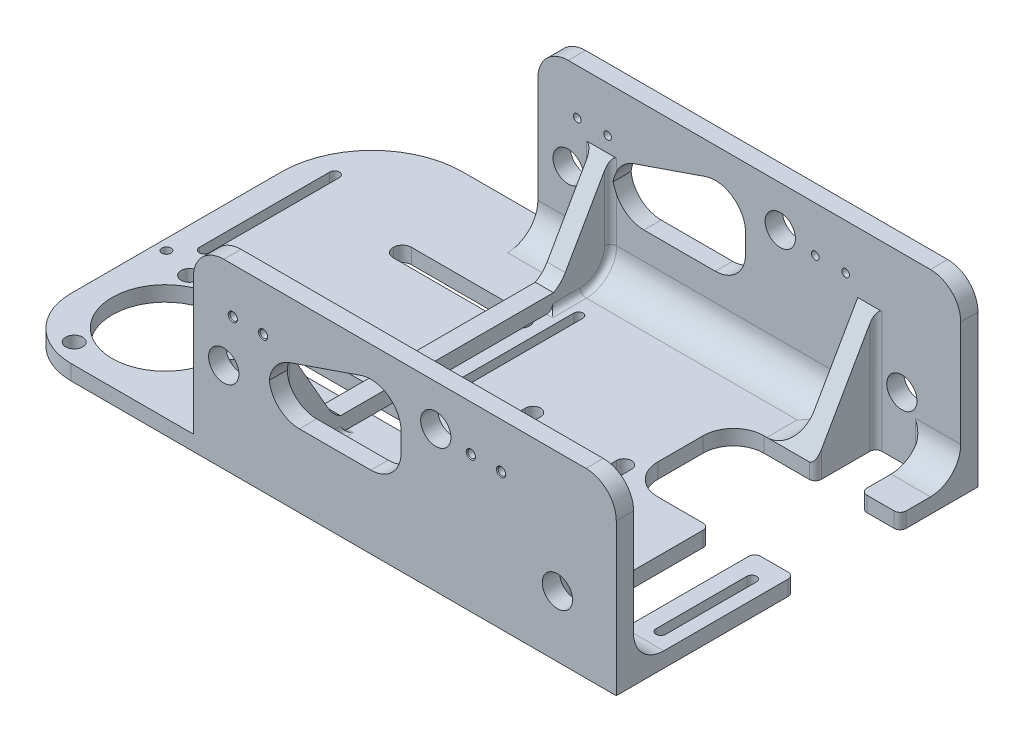
from build123d import *

# Parameters (mm, degrees)
SKETCH_1_W                      = 200
SKETCH_1_H                      = 119.4
EXTRUDE_1_DEPTH                 = 80
CUT_EXTRUDE_1_REACH             = 225.526
SKETCH_2_W                      = 108
SKETCH_2_H                      = 89
CUT_EXTRUDE_2_REACH             = 143.294
SKETCH_3_W                      = 65.43
SKETCH_3_H                      = 77.097998188
CUT_EXTRUDE_2_DIRECTION_2_REACH = 143.294
SKETCH_4_R                      = 17.5
CUT_EXTRUDE_3_DEPTH             = 139.52469094
SKETCH_5_R                      = 2.8
CUT_EXTRUDE_4_DEPTH             = 139.52469094
SKETCH_6_R                      = 5
CUT_EXTRUDE_5_DEPTH             = 176.089577074
SKETCH_7_R                      = 5
CUT_EXTRUDE_6_DEPTH             = 176.089577074
SKETCH_8_R                      = 5
CUT_EXTRUDE_7_DEPTH             = 176.089577074
SKETCH_9_W                      = 15
SKETCH_9_H                      = 108
CUT_EXTRUDE_8_DEPTH             = 139.52469094
FILLET_1_R                      = 15
FILLET_4_R                      = 20
SKETCH_10_W                     = 55
SKETCH_10_H                     = 35
CUT_EXTRUDE_9_DEPTH             = 139.52469094
FILLET_5_R                      = 10
RIB_1_REACH                     = 200.867
SKETCH_11_WALL_W                = 440.045320476
SKETCH_11_WALL_H                = 6
FILLET_6_R                      = 10
FILLET_7_R                      = 30
FILLET_8_R                      = 10
CUT_EXTRUDE_10_DEPTH            = 10
FILLET_9_R                      = 10
FILLET_9_OF_MIRROR_1_R          = 10
SKETCH_17_W                     = 45
SKETCH_17_H                     = 6
CUT_EXTRUDE_11_DEPTH            = 139.52469094
FILLET_10_R                     = 3
CUT_EXTRUDE_12_DEPTH            = 139.52469094
CUT_EXTRUDE_13_DEPTH            = 139.52469094
SKETCH_20_R                     = 1.5
CUT_EXTRUDE_14_DEPTH            = 139.52469094
CUT_EXTRUDE_15_DEPTH            = 139.52469094
CUT_EXTRUDE_16_DEPTH            = 139.52469094
FILLET_11_R                     = 10
FILLET_12_R                     = 2
FILLET_13_R                     = 2
FILLET_14_R                     = 2
FILLET_START                    = 87
FILLET_16_DEPTH                 = 13
FILLET_START_2                  = 84.9999999
FILLET_16_2_DEPTH               = 2.0000001
FILLET_START_3                  = 5
FILLET_16_3_DEPTH               = 10
FILLET_17_R                     = 1
SKETCH_23_W                     = 159.57
SKETCH_23_H                     = 28.76194751
CUT_EXTRUDE_17_DEPTH            = 176.089577131
FILLET_18_R                     = 10
HOLE_WIZARD_M3_1_D              = 2.5
HOLE_WIZARD_M3_1_CSINK_D        = 3.05
HOLE_WIZARD_M3_1_CSINK_ANGLE    = 90
RIB_2_REACH                     = 150.133
SKETCH_27_WALL_W                = 338.577081058
SKETCH_27_WALL_H                = 6
FILLET_20_R                     = 2
FILLET_21_R                     = 2
FILLET_22_R                     = 2
FILLET_23_R                     = 2
SKETCH_28_W                     = 6
SKETCH_28_H                     = 70.285714286
EXTRUDE_2_DEPTH                 = 5
FILLET_24_R                     = 10
FILLET_25_R                     = 10


with BuildPart() as part:
    # 草图1 → 凸台-拉伸1 (new body)
    with BuildSketch(Plane(origin=(0, 0, 0), x_dir=(1, 0, 0), z_dir=(0, 1, 0))):
        Rectangle(SKETCH_1_W, SKETCH_1_H)
    extrude(amount=EXTRUDE_1_DEPTH)

    # 草图2 → 切除-拉伸1 (cut, up to next)
    with BuildSketch(Plane(origin=(100, 0, 0), x_dir=(0, 0, -1), z_dir=(1, 0, 0)), mode=Mode.PRIVATE) as cut_extrude_1_sk1:
        with Locations((0, 49.5)):
            Rectangle(SKETCH_2_W, SKETCH_2_H)
    cut_extrude_1_tool1 = extrude(cut_extrude_1_sk1.sketch, amount=-CUT_EXTRUDE_1_REACH, mode=Mode.PRIVATE) & part.part
    add(cut_extrude_1_tool1.solids().sort_by_distance((100, 49.5, 0))[0], mode=Mode.SUBTRACT)

    # 草图3 → 切除-拉伸2 (cut, up to next)
    with BuildSketch(Plane.XY, mode=Mode.PRIVATE) as cut_extrude_2_sk1:
        with Locations((-72.285, 43.548999094)):
            Rectangle(SKETCH_3_W, SKETCH_3_H)
    cut_extrude_2_tool1 = extrude(cut_extrude_2_sk1.sketch, amount=-CUT_EXTRUDE_2_REACH, mode=Mode.PRIVATE) & part.part
    add(cut_extrude_2_tool1.solids().sort_by_distance((-72.285, 43.548999, 0))[0], mode=Mode.SUBTRACT)

    # 草图3 → 切除-拉伸2 direction 2 (cut, up to next)
    with BuildSketch(Plane.XY, mode=Mode.PRIVATE) as cut_extrude_2_direction_2_sk1:
        with Locations((-72.285, 43.548999094)):
            Rectangle(SKETCH_3_W, SKETCH_3_H)
    cut_extrude_2_direction_2_tool1 = extrude(cut_extrude_2_direction_2_sk1.sketch, amount=CUT_EXTRUDE_2_DIRECTION_2_REACH, mode=Mode.PRIVATE) & part.part
    add(cut_extrude_2_direction_2_tool1.solids().sort_by_distance((-72.285, 43.548999, 0))[0], mode=Mode.SUBTRACT)

    # 草图4 → 切除-拉伸3 (cut, through all)
    with BuildSketch(Plane(origin=(0, 5, 0), x_dir=(1, 0, 0), z_dir=(0, 1, 0))):
        with Locations(Location((-74.57, -34, 0), (0, 0, 270))):
            Circle(SKETCH_4_R)
    extrude(amount=-CUT_EXTRUDE_3_DEPTH, mode=Mode.SUBTRACT)

    # 草图5 → 切除-拉伸4 (cut, through all)
    with BuildSketch(Plane(origin=(0, 5, 0), x_dir=(1, 0, 0), z_dir=(0, 1, 0))):
        with Locations(Location((-52.57, -34, 0), (0, 0, 270))):
            Circle(SKETCH_5_R)
        with Locations(Location((-85.57, -53.052558883, 0), (0, 0, 270))):
            Circle(SKETCH_5_R)
        with Locations(Location((-85.57, -14.947441117, 0), (0, 0, 270))):
            Circle(SKETCH_5_R)
    extrude(amount=-CUT_EXTRUDE_4_DEPTH, mode=Mode.SUBTRACT)

    # 草图6 → 切除-拉伸5 (cut, through all)
    with BuildSketch(Plane.XY.offset(59.7)):
        with Locations((-29.57, 29.65)):
            Circle(SKETCH_6_R)
        with Locations((40.43, 46.502299546)):
            Circle(SKETCH_6_R)
    extrude(amount=-CUT_EXTRUDE_5_DEPTH, mode=Mode.SUBTRACT)

    # 草图7 → 切除-拉伸6 (cut, through all)
    with BuildSketch(Plane.XY.offset(59.7)):
        with Locations((80.57, 20.181577672)):
            Circle(SKETCH_7_R)
    extrude(amount=-CUT_EXTRUDE_6_DEPTH, mode=Mode.SUBTRACT)

    # 草图8 → 切除-拉伸7 (cut, through all)
    with BuildSketch(Plane.XY.offset(59.7)):
        with Locations((38.415103123, 67)):
            Circle(SKETCH_8_R)
    extrude(amount=-CUT_EXTRUDE_7_DEPTH, mode=Mode.SUBTRACT)

    # 草图9 → 切除-拉伸8 (cut, through all)
    with BuildSketch(Plane(origin=(0, 5, 0), x_dir=(1, 0, 0), z_dir=(0, 1, 0))):
        with Locations((79.5, 0)):
            Rectangle(SKETCH_9_W, SKETCH_9_H)
    extrude(amount=-CUT_EXTRUDE_8_DEPTH, mode=Mode.SUBTRACT)

    # 圆角1
    fillet_1_edges = [part.edges().sort_by_distance(p)[0] for p in [
        (100, 80, -56.85),
        (-39.57, 80, 56.85),
        (-39.57, 80, -56.85),
        (100, 80, 56.85),
    ]]
    fillet(fillet_1_edges, radius=FILLET_1_R)

    # 圆角4
    fillet_4_edges = [part.edges().sort_by_distance(p)[0] for p in [
        (-100, 2.5, 59.7),
    ]]
    fillet(fillet_4_edges, radius=FILLET_4_R)

    # 草图10 → 切除-拉伸9 (cut, through all)
    with BuildSketch(Plane(origin=(0, 5, 0), x_dir=(1, 0, 0), z_dir=(0, 1, 0))):
        with Locations((72.5, 16.5)):
            Rectangle(SKETCH_10_W, SKETCH_10_H)
    extrude(amount=-CUT_EXTRUDE_9_DEPTH, mode=Mode.SUBTRACT)

    # 圆角5
    fillet_5_edges = [part.edges().sort_by_distance(p)[0] for p in [
        (45, 2.5, -34),
        (45, 2.5, 1),
    ]]
    fillet(fillet_5_edges, radius=FILLET_5_R)

    # 草图11 wall → 筋1 (add, up to next)
    with BuildSketch(Plane(origin=(72, 22.5, -44), x_dir=(0, -0.868243142124, 0.496138938357), z_dir=(0, -0.496138938357, -0.868243142124)), mode=Mode.PRIVATE) as rib_1_sk1:
        with Locations((0, 3)):
            Rectangle(SKETCH_11_WALL_W, SKETCH_11_WALL_H)
    rib_1_tool1 = extrude(rib_1_sk1.sketch, amount=RIB_1_REACH, mode=Mode.PRIVATE) - part.part
    rib_1 = rib_1_tool1.solids().sort_by_distance((72, 22.5, -44))[0]
    add(rib_1)

    # 圆角6
    fillet_6_edges = [part.edges().sort_by_distance(p)[0] for p in [
        (66, 5, -44),
        (13.215, 5, -54),
    ]]
    fillet(fillet_6_edges, radius=FILLET_6_R)

    # 圆角7
    fillet_7_edges = [part.edges().sort_by_distance(p)[0] for p in [
        (-100, 2.5, -59.7),
    ]]
    fillet(fillet_7_edges, radius=FILLET_7_R)

    # 圆角8
    fillet_8_edges = [part.edges().sort_by_distance(p)[0] for p in [
        (16.215, 5, 54),
    ]]
    fillet(fillet_8_edges, radius=FILLET_8_R)

    # 草图16 → 切除-拉伸10 (cut)
    with BuildSketch(Plane(origin=(0, 0, -59.7), x_dir=(-1, 0, 0), z_dir=(0, 0, -1))):
        Polygon((-28.993163165, 54), (-28.993163165, 24), (14.57, 24), (14.57, 39), align=None)
    cut_extrude_10 = extrude(amount=-CUT_EXTRUDE_10_DEPTH, mode=Mode.SUBTRACT)

    # 圆角9
    # the kernel refuses this fillet: 10 mm, written as the material it adds along each edge
    with BuildSketch(Plane(origin=(-14.57, 24, -59.7), x_dir=(1, 0, 0), z_dir=(0, 0, 1)), Plane(origin=(28.993163165, 24, -59.7), x_dir=(0, 1, 0), z_dir=(0, 0, 1))) as fillet_9_piece_1:
        with BuildLine():
            CenterArc((FILLET_9_R, FILLET_9_R), FILLET_9_R, 180, 90)
            Line((0, FILLET_9_R), (0, 0))
            Line((0, 0), (FILLET_9_R, 0))
        make_face()
    extrude(amount=5.7)
    with BuildSketch(Plane(origin=(-14.57, 39, -59.7), x_dir=(0, -1, 0), z_dir=(0, 0, 1))) as fillet_9_piece_2:
        with BuildLine():
            CenterArc((FILLET_9_R * 0.713293067897, FILLET_9_R), FILLET_9_R, 199, 71)
            Line((-FILLET_9_R * 0.232225507702, FILLET_9_R * 0.674431845543), (0, 0))
            Line((0, 0), (FILLET_9_R * 0.713293067897, 0))
        make_face()
    extrude(amount=5.7)
    with BuildSketch(Plane(origin=(28.993163165, 54, -59.7), x_dir=(0, -1, 0), z_dir=(0, 0, 1))) as fillet_9_piece_3:
        with BuildLine():
            CenterArc((FILLET_9_R * 1.40194829448, -FILLET_9_R), FILLET_9_R, 90, 109)
            Line((FILLET_9_R * 0.456429718877, -FILLET_9_R * 1.32556815446), (0, 0))
            Line((0, 0), (FILLET_9_R * 1.40194829448, 0))
        make_face()
    extrude(amount=5.7)

    # 镜向1: 切除-拉伸10 across plane
    add(cut_extrude_10.mirror(Plane.XY), mode=Mode.SUBTRACT)

    # 圆角9 of 镜向1
    # the kernel refuses this fillet: 10 mm, written as the material it adds along each edge
    with BuildSketch(Plane(origin=(-14.57, 24, 59.7), x_dir=(0, 1, 0), z_dir=(0, 0, -1)), Plane(origin=(28.993163165, 24, 59.7), x_dir=(-1, 0, 0), z_dir=(0, 0, -1))) as fillet_9_of_mirror_1_piece_1:
        with BuildLine():
            CenterArc((FILLET_9_OF_MIRROR_1_R, FILLET_9_OF_MIRROR_1_R), FILLET_9_OF_MIRROR_1_R, 180, 90)
            Line((0, FILLET_9_OF_MIRROR_1_R), (0, 0))
            Line((0, 0), (FILLET_9_OF_MIRROR_1_R, 0))
        make_face()
    extrude(amount=5.7)
    with BuildSketch(Plane(origin=(-14.57, 39, 59.7), x_dir=(0.9455185755993155, 0.3255681544571602, 0), z_dir=(0, 0, -1))) as fillet_9_of_mirror_1_piece_2:
        with BuildLine():
            CenterArc((FILLET_9_OF_MIRROR_1_R * 0.713293067897, FILLET_9_OF_MIRROR_1_R), FILLET_9_OF_MIRROR_1_R, 199, 71)
            Line((-FILLET_9_OF_MIRROR_1_R * 0.232225507702, FILLET_9_OF_MIRROR_1_R * 0.674431845543), (0, 0))
            Line((0, 0), (FILLET_9_OF_MIRROR_1_R * 0.713293067897, 0))
        make_face()
    extrude(amount=5.7)
    with BuildSketch(Plane(origin=(28.993163165, 54, 59.7), x_dir=(-0.9455185755993154, -0.3255681544571606, 0), z_dir=(0, 0, -1))) as fillet_9_of_mirror_1_piece_3:
        with BuildLine():
            CenterArc((FILLET_9_OF_MIRROR_1_R * 1.40194829448, -FILLET_9_OF_MIRROR_1_R), FILLET_9_OF_MIRROR_1_R, 90, 109)
            Line((FILLET_9_OF_MIRROR_1_R * 0.456429718877, -FILLET_9_OF_MIRROR_1_R * 1.32556815446), (0, 0))
            Line((0, 0), (FILLET_9_OF_MIRROR_1_R * 1.40194829448, 0))
        make_face()
    extrude(amount=5.7)

    # 草图17 → 切除-拉伸11 (cut, through all)
    with BuildSketch(Plane(origin=(0, 5, 0), x_dir=(1, 0, 0), z_dir=(0, 1, 0))):
        with Locations((-37.5, 26.7)):
            Rectangle(SKETCH_17_W, SKETCH_17_H)
    extrude(amount=-CUT_EXTRUDE_11_DEPTH, mode=Mode.SUBTRACT)

    # 圆角10
    fillet_10_edges = [part.edges().sort_by_distance(p)[0] for p in [
        (-60, 2.5, -23.7),
        (-15, 2.5, -23.7),
        (-15, 2.5, -29.7),
        (-60, 2.5, -29.7),
    ]]
    fillet(fillet_10_edges, radius=FILLET_10_R - 0.0001)  # a hair under: the kernel refuses the full size

    # 草图18 → 切除-拉伸12 (cut, through all)
    with BuildSketch(Plane(origin=(0, 5, 0), x_dir=(1, 0, 0), z_dir=(0, 1, 0))):
        with BuildLine():
            Line((-50, -16.7), (-2, -16.7))
            ThreePointArc((-2, -16.7), (2, -20.7), (-2, -24.7))
            Line((-2, -24.7), (-50, -24.7))
            ThreePointArc((-50, -24.7), (-54, -20.7), (-50, -16.7))
        make_face()
    extrude(amount=-CUT_EXTRUDE_12_DEPTH, mode=Mode.SUBTRACT)

    # 草图19 → 切除-拉伸13 (cut, through all)
    with BuildSketch(Plane(origin=(0, 5, 0), x_dir=(1, 0, 0), z_dir=(0, 1, 0))):
        with BuildLine():
            Line((-92, -5.3), (-92, 37.7))
            ThreePointArc((-92, 37.7), (-90.4, 39.3), (-88.8, 37.7))
            Line((-88.8, 37.7), (-88.8, -5.3))
            ThreePointArc((-88.8, -5.3), (-90.4, -6.9), (-92, -5.3))
        make_face()
        with BuildLine():
            Line((-11.4, -5.3), (-11.4, 37.7))
            ThreePointArc((-11.4, 37.7), (-9.9, 39.2), (-8.4, 37.7))
            Line((-8.4, 37.7), (-8.4, -5.3))
            ThreePointArc((-8.4, -5.3), (-9.9, -6.8), (-11.4, -5.3))
        make_face()
    extrude(amount=-CUT_EXTRUDE_13_DEPTH, mode=Mode.SUBTRACT)

    # 草图20 → 切除-拉伸14 (cut, through all)
    with BuildSketch(Plane(origin=(0, 5, 0), x_dir=(1, 0, 0), z_dir=(0, 1, 0))):
        with Locations(Location((-96.5, -11.7, 0), (0, 0, 270))):
            Circle(SKETCH_20_R)
    extrude(amount=-CUT_EXTRUDE_14_DEPTH, mode=Mode.SUBTRACT)

    # 草图21 → 切除-拉伸15 (cut, through all)
    with BuildSketch(Plane(origin=(0, 5, 0), x_dir=(1, 0, 0), z_dir=(0, 1, 0))):
        with BuildLine():
            Line((95.6, -9), (95.6, -39))
            ThreePointArc((95.6, -39), (94, -40.6), (92.4, -39))
            Line((92.4, -39), (92.4, -9))
            ThreePointArc((92.4, -9), (94, -7.4), (95.6, -9))
        make_face()
    extrude(amount=-CUT_EXTRUDE_15_DEPTH, mode=Mode.SUBTRACT)

    # 草图22 → 切除-拉伸16 (cut, through all)
    with BuildSketch(Plane(origin=(0, 5, 0), x_dir=(1, 0, 0), z_dir=(0, 1, 0))):
        with BuildLine():
            Line((42.782014456, 2.551460831), (42.782014456, -32.448539169))
            ThreePointArc((42.782014456, -32.448539169), (40.282014456, -34.948539169), (37.782014456, -32.448539169))
            Line((37.782014456, -32.448539169), (37.782014456, 2.551460831))
            ThreePointArc((37.782014456, 2.551460831), (40.282014456, 5.051460831), (42.782014456, 2.551460831))
        make_face()
        with BuildLine():
            Line((12.782014456, 2.551460831), (12.782014456, -32.448539169))
            ThreePointArc((12.782014456, -32.448539169), (10.282014456, -34.948539169), (7.782014456, -32.448539169))
            Line((7.782014456, -32.448539169), (7.782014456, 2.551460831))
            ThreePointArc((7.782014456, 2.551460831), (10.282014456, 5.051460831), (12.782014456, 2.551460831))
        make_face()
    extrude(amount=-CUT_EXTRUDE_16_DEPTH, mode=Mode.SUBTRACT)

    # 圆角11
    fillet_11_edges = [part.edges().sort_by_distance(p)[0] for p in [
        (93.5, 5, 54),
    ]]
    fillet(fillet_11_edges, radius=FILLET_11_R)

    # 圆角12
    fillet_12_edges = [part.edges().sort_by_distance(p)[0] for p in [
        (72, 7.5, 54),
        (72, 20, -54),
    ]]
    fillet(fillet_12_edges, radius=FILLET_12_R)

    # 圆角13
    fillet_13_edges = [part.edges().sort_by_distance(p)[0] for p in [
        (87, 2.5, -54),
        (87, 2.5, 1),
        (87, 2.5, -34),
        (100, 2.5, 1),
        (100, 2.5, -34),
    ]]
    fillet(fillet_13_edges, radius=FILLET_13_R)

    # 圆角14
    fillet_14_edges = [part.edges().sort_by_distance(p)[0] for p in [
        (72, 2.5, -34),
        (72, 2.5, 1),
    ]]
    fillet(fillet_14_edges, radius=FILLET_14_R)

    # 圆角16: read off the stored shape, not the designer's step
    # 圆角16 outline → 圆角16 (add)
    with BuildSketch(Plane.YZ.offset(FILLET_START)):
        with BuildLine():
            Line((5, -54), (15, -54))
            ThreePointArc((15, -54), (7.928932188, -51.071067812), (5, -44))
            Line((5, -44), (5, -54))
        make_face()
    extrude(amount=FILLET_16_DEPTH)

    # Fillet 16 2 outline → Fillet 16 2 (add)
    with BuildSketch(Plane.YZ.offset(FILLET_START_2)):
        with BuildLine():
            Line((5, -54), (15, -54))
            ThreePointArc((15, -54), (7.928932188, -51.071067812), (5, -44))
            Line((5, -44), (5, -54))
        make_face()
    extrude(amount=FILLET_16_2_DEPTH)

    # Fillet 16 3 outline → Fillet 16 3 (cut)
    with BuildSketch(Plane(origin=(0, 0, 0), x_dir=(1, 0, 0), z_dir=(0, 1, 0)).offset(FILLET_START_3)):
        with BuildLine():
            Line((84.9999999, 43), (87, 43))
            Line((87, 43), (87, 52))
            ThreePointArc((87, 52), (86.414213562, 53.414213562), (85, 54))
            Line((85, 54), (84.9999999, 43))
        make_face()
    extrude(amount=FILLET_16_3_DEPTH, mode=Mode.SUBTRACT)

    # 圆角17
    fillet_17_edges = [part.edges().sort_by_distance(p)[0] for p in [
        (87, 7.5, 54),
    ]]
    fillet(fillet_17_edges, radius=FILLET_17_R)

    # 草图23 → 切除-拉伸17 (cut, through all)
    with BuildSketch(Plane.XY.offset(59.7)):
        with Locations((30.215, 74.380973755)):
            Rectangle(SKETCH_23_W, SKETCH_23_H)
    extrude(amount=-CUT_EXTRUDE_17_DEPTH, mode=Mode.SUBTRACT)

    # 圆角18
    fillet_18_edges = [part.edges().sort_by_distance(p)[0] for p in [
        (-39.57, 60, 56.85),
        (100, 60, -56.85),
        (-39.57, 60, -56.85),
        (100, 60, 56.85),
    ]]
    fillet(fillet_18_edges, radius=FILLET_18_R)

    # M3 螺纹孔1 (through all)
    with Locations(Plane(origin=(-26.57, 45, 59.7), x_dir=(1, 0, 0), z_dir=(0, 0, 1))):
        with Locations((0, 0), (10, 0), (78.57, 0), (88.57, 0)):
            CounterSinkHole(HOLE_WIZARD_M3_1_D / 2, HOLE_WIZARD_M3_1_CSINK_D / 2, counter_sink_angle=HOLE_WIZARD_M3_1_CSINK_ANGLE)

    # 镜向2: 筋1 across plane
    add(rib_1.mirror(Plane.XY))

    # 草图27 wall → 筋2 (add, up to next)
    with BuildSketch(Plane(origin=(-21.57, 22.5, -44), x_dir=(0, -0.868243142124, 0.496138938357), z_dir=(0, 0.496138938357, 0.868243142124)), mode=Mode.PRIVATE) as rib_2_sk1:
        with Locations((0, 3)):
            Rectangle(SKETCH_27_WALL_W, SKETCH_27_WALL_H)
    rib_2_tool1 = extrude(rib_2_sk1.sketch, amount=-RIB_2_REACH, mode=Mode.PRIVATE) - part.part
    rib_2 = rib_2_tool1.solids().sort_by_distance((-21.57, 22.5, -44))[0]
    add(rib_2)

    # 镜向3: 筋2 across plane
    add(rib_2.mirror(Plane.XY))

    # 圆角20
    # the kernel refuses this fillet: 2 mm, written as the material it adds along each edge
    with BuildSketch(Plane(origin=(72, 6.5, 54), x_dir=(1, 0, 0), z_dir=(0, 1, 0))) as fillet_20_piece_1_section:
        with BuildLine():
            CenterArc((FILLET_20_R, FILLET_20_R), FILLET_20_R, 180, 90)
            Line((0, FILLET_20_R), (0, 0))
            Line((0, 0), (FILLET_20_R, 0))
        make_face()
    fillet_20_piece_1 = extrude(amount=38.5, mode=Mode.PRIVATE)
    fillet_20_piece_1 = split(fillet_20_piece_1, bisect_by=Plane(origin=(72, 14.746153846, 39.569230769), z_dir=(0, -0.4961389383571569, 0.8682431421242747)), keep=Keep.TOP, mode=Mode.PRIVATE)
    add(fillet_20_piece_1)

    # 圆角21
    # the kernel refuses this fillet: 2 mm, written as the material it adds along each edge
    with BuildSketch(Plane(origin=(-21.57, 15, -44), x_dir=(0, 0, -1), z_dir=(0, 1, 0))) as fillet_21_piece_1:
        with BuildLine():
            CenterArc((10 - FILLET_21_R, FILLET_21_R), FILLET_21_R, 270, 90)
            Line((10, FILLET_21_R), (10, 0))
            Line((10, 0), (10 - FILLET_21_R, 0))
        make_face()
    revolve(axis=Axis((-21.57, 15, -44), (-1, 0, 0)), revolution_arc=90)
    with BuildSketch(Plane(origin=(-15.57, 5, -44), x_dir=(1, 0, 0), z_dir=(0, 0, 1))) as fillet_21_piece_2_section:
        with BuildLine():
            CenterArc((FILLET_21_R, FILLET_21_R), FILLET_21_R, 180, 90)
            Line((0, FILLET_21_R), (0, 0))
            Line((0, 0), (FILLET_21_R, 0))
        make_face()
    fillet_21_piece_2 = extrude(amount=15, mode=Mode.PRIVATE)
    fillet_21_piece_2 = split(fillet_21_piece_2, bisect_by=Plane(origin=(-15.57, 9.307692308, -36.461538462), z_dir=(0, -0.49613893835715694, -0.8682431421242747)), keep=Keep.TOP, mode=Mode.PRIVATE)
    add(fillet_21_piece_2)
    with BuildSketch(Plane(origin=(-15.57, 15, -44), x_dir=(0, 0, -1), z_dir=(0, 1, 0))) as fillet_21_piece_3:
        with BuildLine():
            CenterArc((10 - FILLET_21_R, -FILLET_21_R), FILLET_21_R, 0, 90)
            Line((10 - FILLET_21_R, 0), (10, 0))
            Line((10, 0), (10, -FILLET_21_R))
        make_face()
    revolve(axis=Axis((-15.57, 15, -44), (-1, 0, 0)), revolution_arc=90)
    with BuildSketch(Plane(origin=(-15.57, 15, -54), x_dir=(1, 0, 0), z_dir=(0, 1, 0))) as fillet_21_piece_4_section:
        with BuildLine():
            CenterArc((FILLET_21_R, -FILLET_21_R), FILLET_21_R, 90, 90)
            Line((0, -FILLET_21_R), (0, 0))
            Line((0, 0), (FILLET_21_R, 0))
        make_face()
    fillet_21_piece_4 = extrude(amount=30, mode=Mode.PRIVATE)
    fillet_21_piece_4 = split(fillet_21_piece_4, bisect_by=Plane(origin=(-15.57, 21.153846154, -43.230769231), z_dir=(0, -0.49613893835715694, -0.8682431421242747)), keep=Keep.TOP, mode=Mode.PRIVATE)
    fillet_21_piece_4 = fillet_21_piece_4 - Plane(origin=(-4.57, 31.867069321, -54), x_dir=(0, -1, 0), z_dir=(0, 0, -1)) * Cylinder(10, 68, mode=Mode.PRIVATE)
    fillet_21_piece_4 = fillet_21_piece_4 - Plane(origin=(-4.57, 34, -54), x_dir=(1, 0, 0), z_dir=(0, 0, -1)) * Cylinder(10, 68, mode=Mode.PRIVATE)
    add(fillet_21_piece_4)
    with BuildSketch(Plane(origin=(-15.57, 15, -54), x_dir=(1, 0, 0), z_dir=(0, 1, 0))) as fillet_21_piece_5_section:
        with BuildLine():
            CenterArc((FILLET_21_R, -FILLET_21_R), FILLET_21_R, 90, 90)
            Line((0, -FILLET_21_R), (0, 0))
            Line((0, 0), (FILLET_21_R, 0))
        make_face()
    fillet_21_piece_5 = extrude(amount=30, mode=Mode.PRIVATE)
    fillet_21_piece_5 = fillet_21_piece_5 - Plane(origin=(-4.57, 31.867069321, -54), x_dir=(0, -1, 0), z_dir=(0, 0, -1)) * Cylinder(10, 68, mode=Mode.PRIVATE)
    fillet_21_piece_5 = fillet_21_piece_5 & Plane(origin=(-4.57, 34, -54), x_dir=(1, 0, 0), z_dir=(0, 0, -1)) * Cylinder(10, 68, mode=Mode.PRIVATE)
    add(fillet_21_piece_5)
    with BuildSketch(Plane(origin=(-15.57, 15, -54), x_dir=(1, 0, 0), z_dir=(0, 1, 0))) as fillet_21_piece_6_section:
        with BuildLine():
            CenterArc((FILLET_21_R, -FILLET_21_R), FILLET_21_R, 90, 90)
            Line((0, -FILLET_21_R), (0, 0))
            Line((0, 0), (FILLET_21_R, 0))
        make_face()
    fillet_21_piece_6 = extrude(amount=30, mode=Mode.PRIVATE)
    fillet_21_piece_6 = fillet_21_piece_6 & Plane(origin=(-4.57, 31.867069321, -54), x_dir=(0, -1, 0), z_dir=(0, 0, -1)) * Cylinder(10, 68, mode=Mode.PRIVATE)
    fillet_21_piece_6 = fillet_21_piece_6 - Plane(origin=(-4.57, 34, -54), x_dir=(1, 0, 0), z_dir=(0, 0, -1)) * Cylinder(10, 68, mode=Mode.PRIVATE)
    add(fillet_21_piece_6)
    with BuildSketch(Plane(origin=(-21.57, 5, -29), x_dir=(-1, 0, 0), z_dir=(0, 0, -1))) as fillet_21_piece_7_section:
        with BuildLine():
            CenterArc((FILLET_21_R, FILLET_21_R), FILLET_21_R, 180, 90)
            Line((0, FILLET_21_R), (0, 0))
            Line((0, 0), (FILLET_21_R, 0))
        make_face()
    fillet_21_piece_7 = extrude(amount=15, mode=Mode.PRIVATE)
    fillet_21_piece_7 = split(fillet_21_piece_7, bisect_by=Plane(origin=(-21.57, 2.846153846, -32.769230769), z_dir=(0, -0.49613893835715694, -0.8682431421242747)), keep=Keep.TOP, mode=Mode.PRIVATE)
    add(fillet_21_piece_7)
    with BuildSketch(Plane(origin=(-21.57, 45, -54), x_dir=(-1, 0, 0), z_dir=(0, -1, 0))) as fillet_21_piece_8_section:
        with BuildLine():
            CenterArc((FILLET_21_R, -FILLET_21_R), FILLET_21_R, 90, 90)
            Line((0, -FILLET_21_R), (0, 0))
            Line((0, 0), (FILLET_21_R, 0))
        make_face()
    fillet_21_piece_8 = extrude(amount=30, mode=Mode.PRIVATE)
    fillet_21_piece_8 = split(fillet_21_piece_8, bisect_by=Plane(origin=(-21.57, 43.769230769, -56.153846154), z_dir=(0, -0.49613893835715694, -0.8682431421242747)), keep=Keep.TOP, mode=Mode.PRIVATE)
    add(fillet_21_piece_8)
    with BuildSketch(Plane(origin=(-15.57, 15, 54), x_dir=(0, 0, -1), z_dir=(0, 1, 0))) as fillet_21_piece_9_section:
        with BuildLine():
            CenterArc((FILLET_21_R, -FILLET_21_R), FILLET_21_R, 90, 90)
            Line((0, -FILLET_21_R), (0, 0))
            Line((0, 0), (FILLET_21_R, 0))
        make_face()
    fillet_21_piece_9 = extrude(amount=30, mode=Mode.PRIVATE)
    fillet_21_piece_9 = fillet_21_piece_9 - Plane(origin=(-4.57, 31.867069321, 54), x_dir=(0.9455185755993315, 0.3255681544571141, 0), z_dir=(0, 0, 1)) * Cylinder(10, 68, mode=Mode.PRIVATE)
    fillet_21_piece_9 = fillet_21_piece_9 - Plane(origin=(-4.57, 34, 54), x_dir=(0, 1, 0), z_dir=(0, 0, 1)) * Cylinder(10, 68, mode=Mode.PRIVATE)
    fillet_21_piece_9 = split(fillet_21_piece_9, bisect_by=Plane(origin=(-15.57, 21.153846154, 43.230769231), z_dir=(0, -0.49613893835715694, 0.8682431421242747)), keep=Keep.TOP, mode=Mode.PRIVATE)
    add(fillet_21_piece_9)
    with BuildSketch(Plane(origin=(-15.57, 15, 54), x_dir=(0, 0, -1), z_dir=(0, 1, 0))) as fillet_21_piece_10_section:
        with BuildLine():
            CenterArc((FILLET_21_R, -FILLET_21_R), FILLET_21_R, 90, 90)
            Line((0, -FILLET_21_R), (0, 0))
            Line((0, 0), (FILLET_21_R, 0))
        make_face()
    fillet_21_piece_10 = extrude(amount=30, mode=Mode.PRIVATE)
    fillet_21_piece_10 = fillet_21_piece_10 & Plane(origin=(-4.57, 31.867069321, 54), x_dir=(0.9455185755993315, 0.3255681544571141, 0), z_dir=(0, 0, 1)) * Cylinder(10, 68, mode=Mode.PRIVATE)
    fillet_21_piece_10 = fillet_21_piece_10 - Plane(origin=(-4.57, 34, 54), x_dir=(0, 1, 0), z_dir=(0, 0, 1)) * Cylinder(10, 68, mode=Mode.PRIVATE)
    add(fillet_21_piece_10)
    with BuildSketch(Plane(origin=(-15.57, 15, 54), x_dir=(0, 0, -1), z_dir=(0, 1, 0))) as fillet_21_piece_11_section:
        with BuildLine():
            CenterArc((FILLET_21_R, -FILLET_21_R), FILLET_21_R, 90, 90)
            Line((0, -FILLET_21_R), (0, 0))
            Line((0, 0), (FILLET_21_R, 0))
        make_face()
    fillet_21_piece_11 = extrude(amount=30, mode=Mode.PRIVATE)
    fillet_21_piece_11 = fillet_21_piece_11 - Plane(origin=(-4.57, 31.867069321, 54), x_dir=(0.9455185755993315, 0.3255681544571141, 0), z_dir=(0, 0, 1)) * Cylinder(10, 68, mode=Mode.PRIVATE)
    fillet_21_piece_11 = fillet_21_piece_11 & Plane(origin=(-4.57, 34, 54), x_dir=(0, 1, 0), z_dir=(0, 0, 1)) * Cylinder(10, 68, mode=Mode.PRIVATE)
    add(fillet_21_piece_11)
    with BuildSketch(Plane(origin=(-15.57, 15, 44), x_dir=(0, 0, 1), z_dir=(0, 1, 0))) as fillet_21_piece_12:
        with BuildLine():
            CenterArc((10 - FILLET_21_R, FILLET_21_R), FILLET_21_R, 270, 90)
            Line((10, FILLET_21_R), (10, 0))
            Line((10, 0), (10 - FILLET_21_R, 0))
        make_face()
    revolve(axis=Axis((-15.57, 15, 44), (1, 0, 0)), revolution_arc=90)
    with BuildSketch(Plane(origin=(-15.57, 5, 44), x_dir=(1, 0, 0), z_dir=(0, 0, -1))) as fillet_21_piece_13_section:
        with BuildLine():
            CenterArc((FILLET_21_R, -FILLET_21_R), FILLET_21_R, 90, 90)
            Line((0, -FILLET_21_R), (0, 0))
            Line((0, 0), (FILLET_21_R, 0))
        make_face()
    fillet_21_piece_13 = extrude(amount=15, mode=Mode.PRIVATE)
    fillet_21_piece_13 = split(fillet_21_piece_13, bisect_by=Plane(origin=(-15.57, 9.307692308, 36.461538462), z_dir=(0, -0.49613893835715694, 0.8682431421242747)), keep=Keep.TOP, mode=Mode.PRIVATE)
    add(fillet_21_piece_13)
    with BuildSketch(Plane(origin=(-21.57, 45, 54), x_dir=(0, 0, -1), z_dir=(0, -1, 0))) as fillet_21_piece_14_section:
        with BuildLine():
            CenterArc((FILLET_21_R, -FILLET_21_R), FILLET_21_R, 90, 90)
            Line((0, -FILLET_21_R), (0, 0))
            Line((0, 0), (FILLET_21_R, 0))
        make_face()
    fillet_21_piece_14 = extrude(amount=30, mode=Mode.PRIVATE)
    fillet_21_piece_14 = split(fillet_21_piece_14, bisect_by=Plane(origin=(-21.57, 43.769230769, 56.153846154), z_dir=(0, -0.49613893835715694, 0.8682431421242747)), keep=Keep.TOP, mode=Mode.PRIVATE)
    add(fillet_21_piece_14)
    with BuildSketch(Plane(origin=(-21.57, 15, 44), x_dir=(0, 0, 1), z_dir=(0, 1, 0))) as fillet_21_piece_15:
        with BuildLine():
            CenterArc((10 - FILLET_21_R, -FILLET_21_R), FILLET_21_R, 0, 90)
            Line((10 - FILLET_21_R, 0), (10, 0))
            Line((10, 0), (10, -FILLET_21_R))
        make_face()
    revolve(axis=Axis((-21.57, 15, 44), (1, 0, 0)), revolution_arc=90)
    with BuildSketch(Plane(origin=(-21.57, 5, 29), x_dir=(-1, 0, 0), z_dir=(0, 0, 1))) as fillet_21_piece_16_section:
        with BuildLine():
            CenterArc((FILLET_21_R, -FILLET_21_R), FILLET_21_R, 90, 90)
            Line((0, -FILLET_21_R), (0, 0))
            Line((0, 0), (FILLET_21_R, 0))
        make_face()
    fillet_21_piece_16 = extrude(amount=15, mode=Mode.PRIVATE)
    fillet_21_piece_16 = split(fillet_21_piece_16, bisect_by=Plane(origin=(-21.57, 2.846153846, 32.769230769), z_dir=(0, -0.49613893835715694, 0.8682431421242747)), keep=Keep.TOP, mode=Mode.PRIVATE)
    add(fillet_21_piece_16)

    # 圆角22
    fillet_22_edges = [part.edges().sort_by_distance(p)[0] for p in [
        (66, 7.928932188, 51.071067812),
        (66, 27.5, 54),
        (66, 5, 39),
    ]]
    fillet(fillet_22_edges, radius=FILLET_22_R)

    # 圆角23
    fillet_23_edges = [part.edges().sort_by_distance(p)[0] for p in [
        (-18.57, 5, 34),
        (-18.57, 5, -34),
        (69, 5, 34),
    ]]
    fillet(fillet_23_edges, radius=FILLET_23_R)

    # 草图28 → 凸台-拉伸2 (add)
    with BuildSketch(Plane(origin=(0, 5, 0), x_dir=(1, 0, 0), z_dir=(0, 1, 0))):
        with Locations((-18.57, 0)):
            Rectangle(SKETCH_28_W, SKETCH_28_H)
    extrude(amount=EXTRUDE_2_DEPTH)

    # 圆角24
    # the kernel refuses this fillet: 10 mm, written as the material it adds along each edge
    with BuildSketch(Plane(origin=(-21.57, 7, -35.142857143), x_dir=(0, 1, 0), z_dir=(1, 0, 0))) as fillet_24_piece_1:
        with BuildLine():
            CenterArc((11.780414724, 4.785845512), FILLET_24_R, 208.592997566, 31.662121137)
            Line((6.819025341, -3.896585909), (0, 0))
            Line((0, 0), (3, 0))
        make_face()
    extrude(amount=6)

    # 圆角25
    # the kernel refuses this fillet: 10 mm, written as the material it adds along each edge
    with BuildSketch(Plane(origin=(-15.57, 7, 35.142857143), x_dir=(0, 1, 0), z_dir=(-1, 0, 0))) as fillet_25_piece_1:
        with BuildLine():
            CenterArc((11.780414724, 4.785845512), FILLET_25_R, 208.592997566, 31.662121137)
            Line((6.819025341, -3.896585909), (0, 0))
            Line((0, 0), (3, 0))
        make_face()
    extrude(amount=6)


solid = part.part
